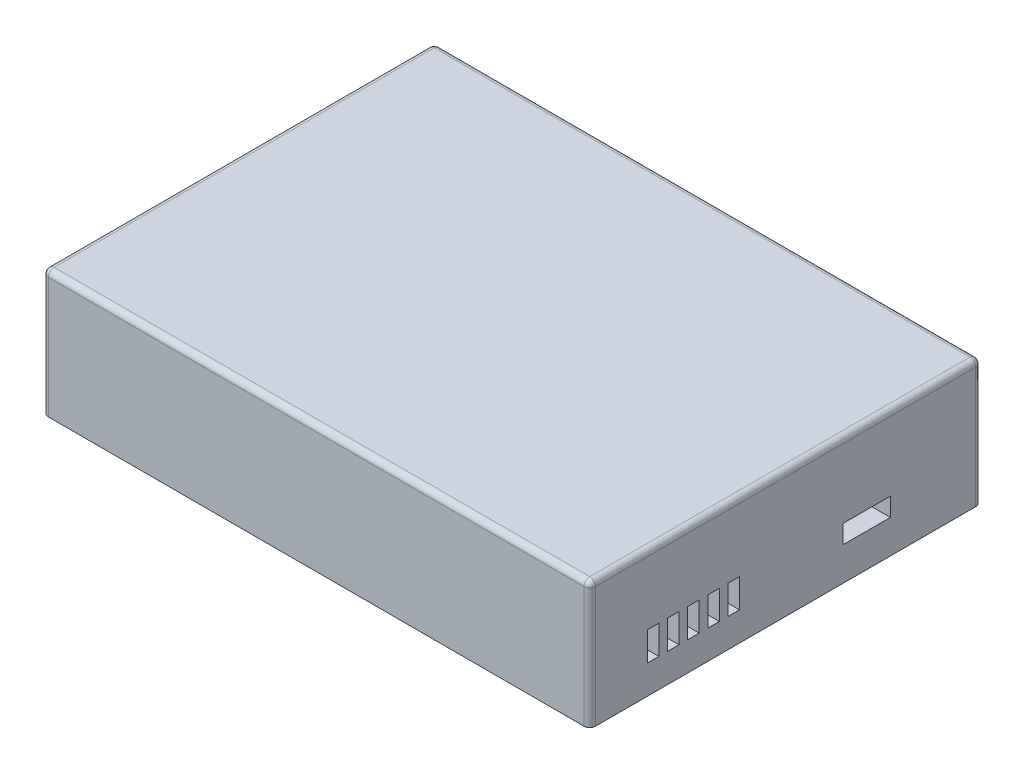
from build123d import *

# Parameters (mm, degrees)
SKETCH_1_W               = 95
SKETCH_1_H               = 68
EXTRUDE_1_DEPTH          = 2
EXTRUDE_2_DEPTH          = 2
EXTRUDE_3_DEPTH          = 2
EXTRUDE_4_DEPTH          = 2
EXTRUDE_5_DEPTH          = 14
SKETCH_7_W               = 6
SKETCH_7_H               = 2
EXTRUDE_6_DEPTH          = 3
SKETCH_8_W               = 3
SKETCH_8_H               = 2
EXTRUDE_7_DEPTH          = 4
SKETCH_9_W               = 0.2
SKETCH_9_H               = 1.8
EXTRUDE_8_DEPTH          = 2
SKETCH_13_W              = 3
SKETCH_13_H              = 56
EXTRUDE_10_DEPTH         = 4
CHAMFER_6_SIZE           = 3
EXTRUDE_11_DEPTH         = 2
SKETCH_15_W              = 3
SKETCH_15_H              = 2
EXTRUDE_12_DEPTH         = 3
SKETCH_16_W              = 1.8
SKETCH_16_H              = 0.2
SKETCH_16_W_2            = 1
EXTRUDE_13_DEPTH         = 2
SKETCH_17_W              = 8
SKETCH_17_H              = 56
EXTRUDE_15_DEPTH         = 11
SKETCH_18_W              = 8
SKETCH_18_H              = 38
SKETCH_18_H_2            = 9.8
EXTRUDE_16_DEPTH         = 3.2
SKETCH_19_W              = 8
SKETCH_19_H              = 56
EXTRUDE_17_DEPTH         = 5.8
SKETCH_20_W              = 3
SKETCH_20_H              = 56
EXTRUDE_18_DEPTH         = 4
CHAMFER_7_SIZE           = 3
CHAMFER_8_SIZE           = 1
SKETCH_22_R              = 2.1
CUT_EXTRUDE_1_DEPTH      = 2.6
CUT_EXTRUDE_2_DEPTH      = 103.863987867
CUT_EXTRUDE_2_DEPTH_BACK = 103.863987867
SKETCH_23_W              = 2
SKETCH_23_H              = 5
FILLET_1_R               = 1
FILLET_2_R               = 1


with BuildPart() as part:
    # 草图1 → 凸台-拉伸1 (new body)
    with BuildSketch(Plane(origin=(0, 0, 0), x_dir=(1, 0, 0), z_dir=(0, 1, 0))):
        Rectangle(SKETCH_1_W, SKETCH_1_H)
    extrude(amount=EXTRUDE_1_DEPTH)

    # 草图3 → 凸台-拉伸2 (add)
    with BuildSketch(Plane.XZ):
        Polygon((-47.5, 34), (-39.5, 34), (47.5, 34), (47.5, 28), (-39.5, 28), (-39.5, -28), (47.5, -28), (47.5, -34), (-39.5, -34), (-47.5, -34), align=None)
    extrude(amount=EXTRUDE_2_DEPTH)

    # 草图4 → 凸台-拉伸3 (add)
    with BuildSketch(Plane.XZ.offset(2)):
        Polygon((-47.5, 34), (47.5, 34), (47.5, 28), (-45.5, 28), (-45.5, -28), (47.5, -28), (47.5, -34), (-47.5, -34), (-47.5, -28), (-47.5, 28), align=None)
    extrude(amount=EXTRUDE_3_DEPTH)

    # 草图5 → 凸台-拉伸4 (add)
    with BuildSketch(Plane.XZ.offset(4)):
        Polygon((-47.5, 34), (-45.5, 34), (47.5, 34), (47.5, 28), (-45.5, 28), (-45.5, 21), (-47.5, 21), align=None)
        Polygon((-47.5, 8), (-45.5, 8), (-45.5, -28), (47.5, -28), (47.5, -34), (-45.5, -34), (-47.5, -34), align=None)
    extrude(amount=EXTRUDE_4_DEPTH)

    # 草图6 → 凸台-拉伸5 (add)
    with BuildSketch(Plane.XZ.offset(6)):
        Polygon((-47.5, 34), (-45.5, 34), (47.5, 34), (47.5, 28), (-45.5, 28), (-45.5, -28), (47.5, -28), (47.5, -34), (-45.5, -34), (-47.5, -34), align=None)
    extrude(amount=EXTRUDE_5_DEPTH)

    # 草图7 → 凸台-拉伸6 (add)
    with BuildSketch(Plane(origin=(-45.5, 0, 0), x_dir=(0, 0, -1), z_dir=(1, 0, 0))):
        with Locations((-25, -5)):
            Rectangle(SKETCH_7_W, SKETCH_7_H)
        with Locations((-1, -5)):
            Rectangle(SKETCH_7_W, SKETCH_7_H)
    extrude(amount=EXTRUDE_6_DEPTH)

    # 草图8 → 凸台-拉伸7 (add)
    with BuildSketch(Plane.XZ.offset(2)):
        with Locations((-44, -3)):
            Rectangle(SKETCH_8_W, SKETCH_8_H)
    extrude(amount=EXTRUDE_7_DEPTH)

    # 草图9 → 凸台-拉伸8 (add)
    with BuildSketch(Plane.XZ.offset(2)):
        with Locations((-42.6, 22.9)):
            Rectangle(SKETCH_9_W, SKETCH_9_H)
        with Locations((-42.6, 24.9)):
            Rectangle(SKETCH_9_W, SKETCH_9_H)
        with Locations((-42.6, 26.9)):
            Rectangle(SKETCH_9_W, SKETCH_9_H)
        with Locations((-42.6, 3.1)):
            Rectangle(SKETCH_9_W, SKETCH_9_H)
        with Locations((-42.6, 1.1)):
            Rectangle(SKETCH_9_W, SKETCH_9_H)
        with Locations((-42.6, -0.9)):
            Rectangle(SKETCH_9_W, SKETCH_9_H)
    extrude(amount=EXTRUDE_8_DEPTH)

    # 草图13 → 凸台-拉伸10 (add)
    with BuildSketch(Plane.XZ.offset(20)):
        with Locations((-44, 0)):
            Rectangle(SKETCH_13_W, SKETCH_13_H)
    extrude(amount=-EXTRUDE_10_DEPTH)

    # 倒角6
    chamfer_6_edges = [part.edges().sort_by_distance(p)[0] for p in [
        (-42.5, -16, 0),
    ]]
    chamfer(chamfer_6_edges, length=CHAMFER_6_SIZE - 0.0001)  # a hair under: the kernel refuses the full size

    # 草图14 → 凸台-拉伸11 (add)
    with BuildSketch(Plane.XZ):
        Polygon((16.5, 28), (16.5, -2), (19.5, -2), (22.5, -2), (22.5, 28), (19.5, 28), align=None)
    extrude(amount=EXTRUDE_11_DEPTH)

    # 草图15 → 凸台-拉伸12 (add)
    with BuildSketch(Plane(origin=(0, 0, 28), x_dir=(-1, 0, 0), z_dir=(0, 0, -1))):
        with Locations((-18, -5)):
            Rectangle(SKETCH_15_W, SKETCH_15_H)
    extrude(amount=EXTRUDE_12_DEPTH)

    # 草图16 → 凸台-拉伸13 (add)
    with BuildSketch(Plane.XZ.offset(2)):
        with Locations((17.4, 25.1)):
            Rectangle(SKETCH_16_W, SKETCH_16_H)
        with Locations((19, 25.1)):
            Rectangle(SKETCH_16_W_2, SKETCH_16_H)
    extrude(amount=EXTRUDE_13_DEPTH)

    # 草图17 → 凸台-拉伸15 (add)
    with BuildSketch(Plane.XZ):
        with Locations((43.5, 0)):
            Rectangle(SKETCH_17_W, SKETCH_17_H)
    extrude(amount=EXTRUDE_15_DEPTH)

    # 草图18 → 凸台-拉伸16 (add)
    with BuildSketch(Plane.XZ.offset(11)):
        with Locations((43.5, 9)):
            Rectangle(SKETCH_18_W, SKETCH_18_H)
        with Locations((43.5, -23.1)):
            Rectangle(SKETCH_18_W, SKETCH_18_H_2)
    extrude(amount=EXTRUDE_16_DEPTH)

    # 草图19 → 凸台-拉伸17 (add)
    with BuildSketch(Plane.XZ.offset(14.2)):
        with Locations((43.5, 0)):
            Rectangle(SKETCH_19_W, SKETCH_19_H)
    extrude(amount=EXTRUDE_17_DEPTH)

    # 草图20 → 凸台-拉伸18 (add)
    with BuildSketch(Plane.XZ.offset(20)):
        with Locations((38, 0)):
            Rectangle(SKETCH_20_W, SKETCH_20_H)
    extrude(amount=-EXTRUDE_18_DEPTH)

    # 倒角7
    chamfer_7_edges = [part.edges().sort_by_distance(p)[0] for p in [
        (36.5, -16, 0),
    ]]
    chamfer(chamfer_7_edges, length=CHAMFER_7_SIZE - 0.0001)  # a hair under: the kernel refuses the full size

    # 倒角8
    chamfer_8_edges = [part.edges().sort_by_distance(p)[0] for p in [
        (-47.5, -6, 14.5),
    ]]
    chamfer(chamfer_8_edges, length=CHAMFER_8_SIZE)

    # 草图22 → 切除-拉伸1 (cut)
    with BuildSketch(Plane.XZ.offset(20)):
        with Locations(Location((-44.5, 31, 0), (0, 0, 270))):
            Circle(SKETCH_22_R)
        with Locations(Location((0, 31, 0), (0, 0, 270))):
            Circle(SKETCH_22_R)
        with Locations(Location((44.5, 31, 0), (0, 0, 270))):
            Circle(SKETCH_22_R)
        with Locations(Location((44.5, -31, 0), (0, 0, 270))):
            Circle(SKETCH_22_R)
        with Locations(Location((0, -31, 0), (0, 0, 270))):
            Circle(SKETCH_22_R)
        with Locations(Location((-44.5, -31, 0), (0, 0, 270))):
            Circle(SKETCH_22_R)
    extrude(amount=-CUT_EXTRUDE_1_DEPTH, mode=Mode.SUBTRACT)

    # 草图23 → 切除-拉伸2 (cut, two sides: drawn at the far end of the back side and taken through both)
    with BuildSketch(Plane(origin=(47.5, 0, 0), x_dir=(0, 0, -1), z_dir=(1, 0, 0)).offset(-CUT_EXTRUDE_2_DEPTH_BACK)):
        with Locations((-23, -12.5)):
            Rectangle(SKETCH_23_W, SKETCH_23_H)
        with Locations((-19.5, -12.5)):
            Rectangle(SKETCH_23_W, SKETCH_23_H)
        with Locations((-16, -12.5)):
            Rectangle(SKETCH_23_W, SKETCH_23_H)
        with Locations((-12.5, -12.5)):
            Rectangle(SKETCH_23_W, SKETCH_23_H)
        with Locations((-9, -12.5)):
            Rectangle(SKETCH_23_W, SKETCH_23_H)
    extrude(amount=CUT_EXTRUDE_2_DEPTH + CUT_EXTRUDE_2_DEPTH_BACK, mode=Mode.SUBTRACT)

    # 圆角1
    fillet_1_edges = [part.edges().sort_by_distance(p)[0] for p in [
        (-47.5, -9, -34),
        (47.5, -9, -34),
        (47.5, -9, 34),
        (-47.5, -9, 34),
    ]]
    fillet(fillet_1_edges, radius=FILLET_1_R)

    # 圆角2
    fillet_2_edges = [part.edges().sort_by_distance(p)[0] for p in [
        (0, 2, -34),
        (47.5, 2, 0),
        (-47.5, 2, 0),
        (0, 2, 34),
        (-47.207106781, 2, 33.707106781),
        (-47.207106781, 2, -33.707106781),
        (47.207106781, 2, 33.707106781),
        (47.207106781, 2, -33.707106781),
    ]]
    fillet(fillet_2_edges, radius=FILLET_2_R)


solid = part.part
